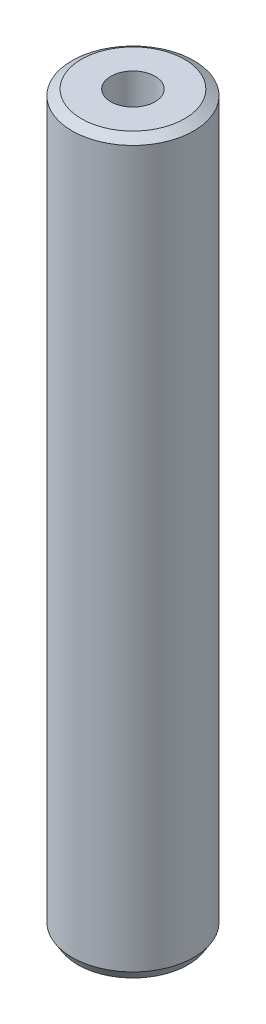
from build123d import *
from OCP.BRepFilletAPI import BRepFilletAPI_MakeChamfer

# Parameters (mm, degrees)
SKETCH1_R           = 50
BOSS_EXTRUDE1_DEPTH = 600
SKETCH2_R           = 18.161114409
CUT_EXTRUDE1_DEPTH  = 605.15229868
CHAMFER1_SIZE       = 4.77216119
CHAMFER1_SIZE2      = 7.670587231


with BuildPart() as part:
    # Sketch1 → Boss-Extrude1 (new body)
    with BuildSketch(Plane(origin=(0, 0, 0), x_dir=(1, 0, 0), z_dir=(0, 1, 0))):
        Circle(SKETCH1_R)
    extrude(amount=BOSS_EXTRUDE1_DEPTH)

    # Sketch2 → Cut-Extrude1 (cut, through all)
    with BuildSketch(Plane(origin=(0, 0, 0), x_dir=(1, 0, 0), z_dir=(0, 1, 0))):
        Circle(SKETCH2_R)
    extrude(amount=CUT_EXTRUDE1_DEPTH, mode=Mode.SUBTRACT)

    # Chamfer1: one chamfer whose edges measure the first distance from different faces: ONE call of the kernel's chamfer builder (chamfer() names one face for all edges)
    chamfer1_edges_1 = [part.edges().sort_by_distance(p)[0] for p in [
        (-50, 600, 0),
    ]]
    chamfer1_side_1 = [part.faces().sort_by_distance(p)[0] for p in [
        (-50, 300, 0),
    ]]
    chamfer1_edges_2 = [part.edges().sort_by_distance(p)[0] for p in [
        (-50, 0, 0),
    ]]
    chamfer1_side_2 = [part.faces().sort_by_distance(p)[0] for p in [
        (-48.585786438, 0, 0),
    ]]
    chamfer1 = BRepFilletAPI_MakeChamfer(part.part.solid().wrapped)
    for e in chamfer1_edges_1:
        chamfer1.Add(CHAMFER1_SIZE, CHAMFER1_SIZE2, e.wrapped, chamfer1_side_1[0].wrapped)  # the first distance lies on this face
    for e in chamfer1_edges_2:
        chamfer1.Add(CHAMFER1_SIZE, CHAMFER1_SIZE2, e.wrapped, chamfer1_side_2[0].wrapped)  # the first distance lies on this face
    add(Compound.cast(chamfer1.Shape()), mode=Mode.REPLACE)


solid = part.part
